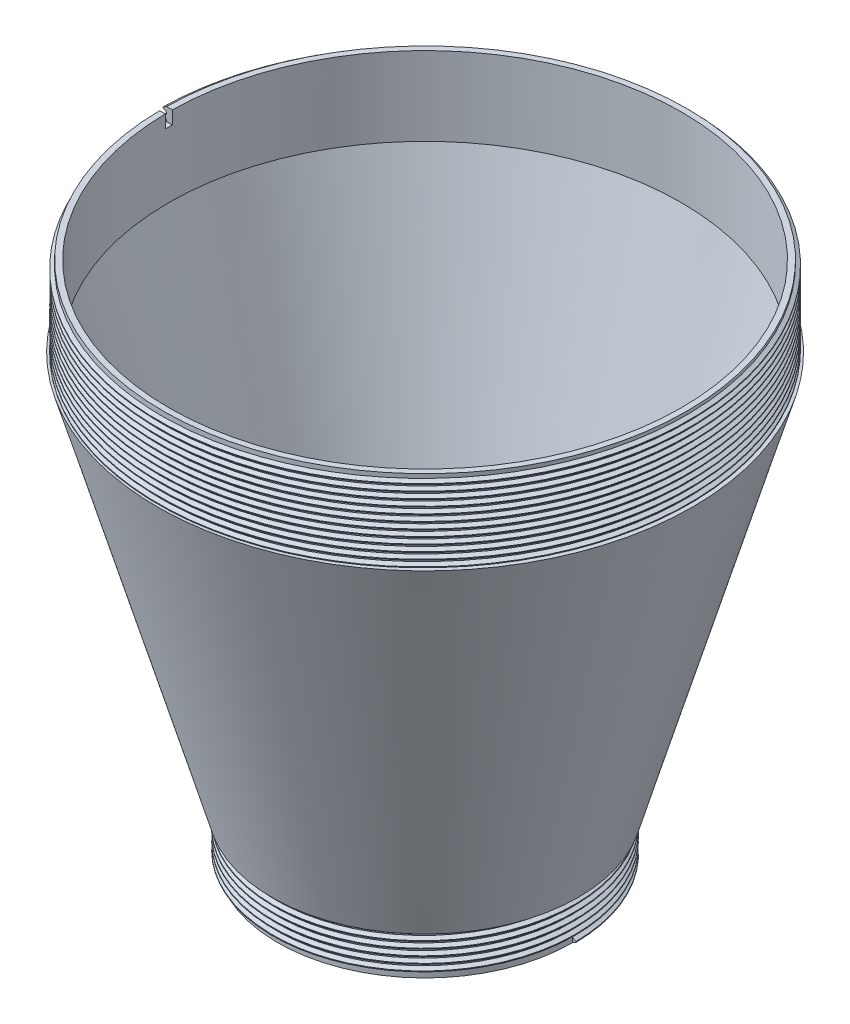
from build123d import *

# Parameters (mm, degrees)
THREAD1_PITCH      = 1.5
THREAD2_PITCH      = 1.5
CUT_EXTRUDE1_DEPTH = 100


with BuildPart() as part:
    # Sketch1 → Revolve1 (revolve)
    with BuildSketch(Plane.XY, mode=Mode.PRIVATE) as revolve1_sk:
        Polygon((-35.1, -40.041653069), (-61.3, 50.517321357), (-60, 50.517321357), (-60, 68.885872633), (-58.7, 68.885872633), (-58.7, 50.885872633), (-32.5, -39.673101793), (-32.5, -39.708823405), (-32.5, -49.708823405), (-33.75, -49.708823405), (-33.75, -40.034347268), (-35.1, -40.034347268), align=None)
    revolve(revolve1_sk.sketch.rotate(Axis((0, -1000, 0), (0, 1, 0)), 180), axis=Axis((0, -1000, 0), (0, 1, 0)))

    # Thread1: the profile of Thread Profile1 profile screwed along a right-hand helix of 6.449651 turns, 8 arcs to a turn; built about Z, then put on its axis
    thread1_z = Axis((0, 0, 0), (0, 0, 1))
    thread1_corners = [(33.7497, 0, -0.000173205), (34.561898813, 0, 0.468749998), (34.561898813, 0, 0.656249998), (33.7497, 0, 1.125173201)]
    with BuildLine(mode=Mode.PRIVATE) as thread1_profile:
        Line(thread1_corners[0], thread1_corners[1])
        Line(thread1_corners[1], thread1_corners[2])
        Line(thread1_corners[2], thread1_corners[3])
        Line(thread1_corners[3], thread1_corners[0])
    thread1_cap = Face(thread1_profile.wire())
    thread1_turn_angles = [0, 22.5, 45, 67.5, 90, 112.5, 135, 157.5, 180, 202.5, 225, 247.5, 270, 292.5, 315, 337.5, 360]
    thread1_turn_weights = [1, 0.9238795325112867, 1, 0.9238795325112867, 1, 0.9238795325112867, 1, 0.9238795325112867, 1, 0.9238795325112867, 1, 0.9238795325112867, 1, 0.9238795325112867, 1, 0.9238795325112867, 1]
    thread1_turn_rails = [Edge.make_bspline([Vector(p[0], p[1], 0).rotate(thread1_z, thread1_turn_angles[k]) / thread1_turn_weights[k] + Vector(0, 0, p[2] + THREAD1_PITCH * thread1_turn_angles[k] / 360) for k in range(17)], [0, 0, 0, 1, 1, 2, 2, 3, 3, 4, 4, 5, 5, 6, 6, 7, 7, 8, 8, 8], 2, thread1_turn_weights) for p in thread1_corners]
    thread1_turn_sides = [Face.make_surface_from_curves(thread1_turn_rails[p[0]], thread1_turn_rails[p[1]]) for p in [(0, 1), (1, 2), (2, 3), (3, 0)]]
    thread1_last_angles = [2160, 2182.5, 2205, 2227.5, 2250, 2272.5, 2295, 2308.4371365, 2321.874273]
    thread1_last_weights = [1, 0.9238795325112867, 1, 0.9238795325112867, 1, 0.9238795325112867, 1, 0.9726254655092086, 1]
    thread1_last_rails = [Edge.make_bspline([Vector(p[0], p[1], 0).rotate(thread1_z, thread1_last_angles[k]) / thread1_last_weights[k] + Vector(0, 0, p[2] + THREAD1_PITCH * thread1_last_angles[k] / 360) for k in range(9)], [0, 0, 0, 1, 1, 2, 2, 3, 3, 4, 4, 4], 2, thread1_last_weights) for p in thread1_corners]
    thread1_last_sides = [Face.make_surface_from_curves(thread1_last_rails[p[0]], thread1_last_rails[p[1]]) for p in [(0, 1), (1, 2), (2, 3), (3, 0)]]
    thread1 = Plane(origin=(0, -49.708823405, 0), x_dir=(1, 0, 0), z_dir=(0, 1, 0)) * Solid(Shell([*[p.moved(Location((0, 0, THREAD1_PITCH * i))) for i in range(6) for p in thread1_turn_sides], *thread1_last_sides, thread1_cap, thread1_cap.rotate(thread1_z, 2321.874273).moved(Location((0, 0, THREAD1_PITCH * 2321.874273 / 360)))]))
    add(thread1)

    # Thread2: the profile of Thread Profile2 profile screwed along a right-hand helix of 12.245701 turns, 8 arcs to a turn; built about Z, then put on its axis
    thread2_z = Axis((0, 0, 0), (0, 0, 1))
    thread2_corners = [(59.9997, 0, -0.000173205), (60.811898813, 0, 0.468749998), (60.811898813, 0, 0.656249998), (59.9997, 0, 1.125173201)]
    with BuildLine(mode=Mode.PRIVATE) as thread2_profile:
        Line(thread2_corners[0], thread2_corners[1])
        Line(thread2_corners[1], thread2_corners[2])
        Line(thread2_corners[2], thread2_corners[3])
        Line(thread2_corners[3], thread2_corners[0])
    thread2_cap = Face(thread2_profile.wire())
    thread2_turn_angles = [0, 22.5, 45, 67.5, 90, 112.5, 135, 157.5, 180, 202.5, 225, 247.5, 270, 292.5, 315, 337.5, 360]
    thread2_turn_weights = [1, 0.9238795325112867, 1, 0.9238795325112867, 1, 0.9238795325112867, 1, 0.9238795325112867, 1, 0.9238795325112867, 1, 0.9238795325112867, 1, 0.9238795325112867, 1, 0.9238795325112867, 1]
    thread2_turn_rails = [Edge.make_bspline([Vector(p[0], p[1], 0).rotate(thread2_z, thread2_turn_angles[k]) / thread2_turn_weights[k] + Vector(0, 0, p[2] + THREAD2_PITCH * thread2_turn_angles[k] / 360) for k in range(17)], [0, 0, 0, 1, 1, 2, 2, 3, 3, 4, 4, 5, 5, 6, 6, 7, 7, 8, 8, 8], 2, thread2_turn_weights) for p in thread2_corners]
    thread2_turn_sides = [Face.make_surface_from_curves(thread2_turn_rails[p[0]], thread2_turn_rails[p[1]]) for p in [(0, 1), (1, 2), (2, 3), (3, 0)]]
    thread2_last_angles = [4320, 4342.5, 4365, 4386.726153088, 4408.452306176]
    thread2_last_weights = [1, 0.9238795325112867, 1, 0.9289637010656756, 1]
    thread2_last_rails = [Edge.make_bspline([Vector(p[0], p[1], 0).rotate(thread2_z, thread2_last_angles[k]) / thread2_last_weights[k] + Vector(0, 0, p[2] + THREAD2_PITCH * thread2_last_angles[k] / 360) for k in range(5)], [0, 0, 0, 1, 1, 2, 2, 2], 2, thread2_last_weights) for p in thread2_corners]
    thread2_last_sides = [Face.make_surface_from_curves(thread2_last_rails[p[0]], thread2_last_rails[p[1]]) for p in [(0, 1), (1, 2), (2, 3), (3, 0)]]
    thread2 = Plane(origin=(0, 68.885872633, 0), x_dir=(-1, 0, 0), z_dir=(0, -1, 0)) * Solid(Shell([*[p.moved(Location((0, 0, THREAD2_PITCH * i))) for i in range(12) for p in thread2_turn_sides], *thread2_last_sides, thread2_cap, thread2_cap.rotate(thread2_z, 4408.452306176).moved(Location((0, 0, THREAD2_PITCH * 4408.452306176 / 360)))]))
    add(thread2)

    # Sketch2 → Cut-Extrude1 (cut)
    with BuildSketch(Plane(origin=(0, 0, 0), x_dir=(0, 0, -1), z_dir=(1, 0, 0))):
        Polygon((-0.805072062, 68.882829686), (-0.805072062, 69.699020341), (0.804437725, 69.699020341), (0.804437725, 68.882829686), (0.804437725, 65.888917972), (-0.805072062, 65.888917972), align=None)
    extrude(amount=-CUT_EXTRUDE1_DEPTH, mode=Mode.SUBTRACT)


solid = part.part
